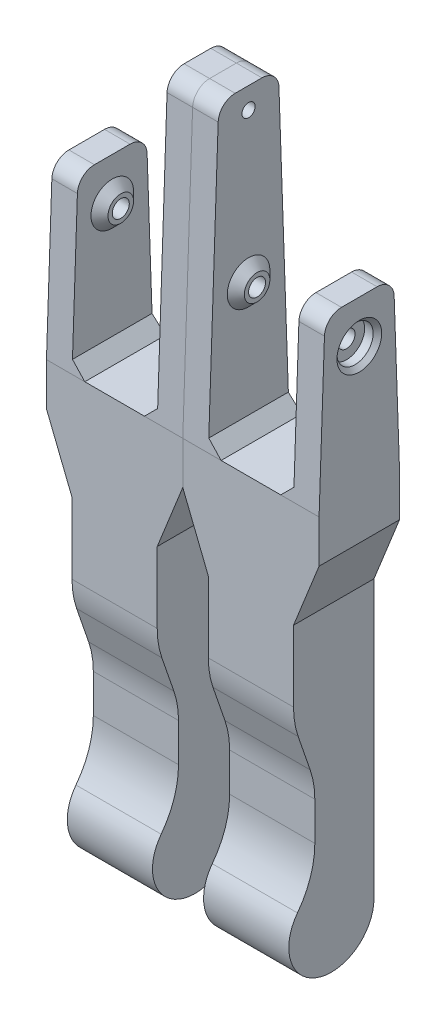
from build123d import *

# Parameters (mm, degrees)
SKETCH1_R           = 2
BOSS_EXTRUDE1_DEPTH = 6
SKETCH2_R           = 4.25
CUT_EXTRUDE1_DEPTH  = 3
SKETCH3_W           = 18.888907728
SKETCH3_H           = 10
BOSS_EXTRUDE2_DEPTH = 32
BOSS_EXTRUDE3_START = -6
SKETCH4_R           = 2
BOSS_EXTRUDE3_DEPTH = 6
FILLET1_R           = 4
CUT_EXTRUDE2_START  = -29
SKETCH2_2_R         = 4.25
CUT_EXTRUDE2_DEPTH  = 3
CHAMFER1_SIZE       = 1
CHAMFER2_SIZE       = 3
SKETCH5_R           = 3
SKETCH5_R_2         = 2
BOSS_EXTRUDE4_DEPTH = 2
BOSS_EXTRUDE5_START = 18
SKETCH5_2_R         = 3
SKETCH5_2_R_2       = 2
BOSS_EXTRUDE5_DEPTH = 2
CHAMFER4_SIZE       = 2
BOSS_EXTRUDE6_DEPTH = 18.888907729
BOSS_EXTRUDE7_DEPTH = 20
CHAMFER5_SIZE       = 15
CHAMFER5_SIZE_2     = 5.164914199
FILLET2_R           = 20
SKETCH9_R           = 1.55
CUT_EXTRUDE3_DEPTH  = 6
CUT_EXTRUDE4_START  = -3
SKETCH10_R          = 3.25
SKETCH10_R_2        = 1.55
CUT_EXTRUDE4_DEPTH  = 3
CHAMFER6_SIZE       = 1


# Some blends are built 0.0001 mm under size
with BuildPart() as part:
    # Sketch1 → Boss-Extrude1 (new body)
    with BuildSketch(Plane(origin=(0, 0, 0), x_dir=(0, 0, -1), z_dir=(1, 0, 0))):
        Polygon((-9.444453864, -30), (-7, 40), (7, 40), (9.444453864, -30), align=None)
        Circle(SKETCH1_R, mode=Mode.SUBTRACT)
    extrude(amount=BOSS_EXTRUDE1_DEPTH)

    # Sketch2 → Cut-Extrude1 (cut)
    with BuildSketch(Plane.ZY):
        Circle(SKETCH2_R)
    extrude(amount=-CUT_EXTRUDE1_DEPTH, mode=Mode.SUBTRACT)

    # Sketch3 → Boss-Extrude2 (add)
    with BuildSketch(Plane.ZY):
        with Locations((0, -35)):
            Rectangle(SKETCH3_W, SKETCH3_H)
    extrude(amount=-BOSS_EXTRUDE2_DEPTH)

    # Sketch4 → Boss-Extrude3 (add)
    with BuildSketch(Plane(origin=(32, 0, 0), x_dir=(0, 0, -1), z_dir=(1, 0, 0)).offset(BOSS_EXTRUDE3_START)):
        Polygon((9.444453864, -30), (-9.444453864, -30), (-8.047623085, 10), (8.047623085, 10), align=None)
        with Locations(Location((0, 0, 0), (0, 0, 180))):
            Circle(SKETCH4_R, mode=Mode.SUBTRACT)
    extrude(amount=BOSS_EXTRUDE3_DEPTH)

    # Fillet1
    fillet1_edges = [part.edges().sort_by_distance(p)[0] for p in [
        (29, 10, -8.047623085),
        (29, 10, 8.047623085),
        (3, 40, 7),
        (3, 40, -7),
    ]]
    fillet(fillet1_edges, radius=FILLET1_R)

    # Sketch2<2> → Cut-Extrude2 (cut)
    with BuildSketch(Plane.ZY.offset(CUT_EXTRUDE2_START)):
        Circle(SKETCH2_2_R)
    extrude(amount=-CUT_EXTRUDE2_DEPTH, mode=Mode.SUBTRACT)

    # Chamfer1
    chamfer1_edges = [part.edges().sort_by_distance(p)[0] for p in [
        (0, 0, -4.25),
        (32, 0, -4.25),
    ]]
    chamfer(chamfer1_edges, length=CHAMFER1_SIZE)

    # Chamfer2
    chamfer2_edges = [part.edges().sort_by_distance(p)[0] for p in [
        (26, -30, 0),
        (6, -30, 0),
    ]]
    chamfer(chamfer2_edges, length=CHAMFER2_SIZE)

    # Sketch5 → Boss-Extrude4 (add)
    with BuildSketch(Plane(origin=(6, 0, 0), x_dir=(0, 0, -1), z_dir=(1, 0, 0))):
        with Locations(Location((0, 0, 0), (0, 0, 180))):
            Circle(SKETCH5_R)
        with Locations(Location((0, 0, 0), (0, 0, 180))):
            Circle(SKETCH5_R_2, mode=Mode.SUBTRACT)
    extrude(amount=BOSS_EXTRUDE4_DEPTH)

    # Sketch5<2> → Boss-Extrude5 (add)
    with BuildSketch(Plane(origin=(6, 0, 0), x_dir=(0, 0, -1), z_dir=(1, 0, 0)).offset(BOSS_EXTRUDE5_START)):
        with Locations(Location((0, 0, 0), (0, 0, 180))):
            Circle(SKETCH5_2_R)
        with Locations(Location((0, 0, 0), (0, 0, 180))):
            Circle(SKETCH5_2_R_2, mode=Mode.SUBTRACT)
    extrude(amount=BOSS_EXTRUDE5_DEPTH)

    # Chamfer4
    chamfer4_edges = [part.edges().sort_by_distance(p)[0] for p in [
        (6, 0, -3),
        (26, 0, -3),
    ]]
    chamfer(chamfer4_edges, length=CHAMFER4_SIZE - 0.0001)  # a hair under: the kernel refuses the full size

    # Sketch7 → Boss-Extrude6 (add)
    with BuildSketch(Plane(origin=(0, 0, -9.444453864), x_dir=(-1, 0, 0), z_dir=(0, 0, -1))):
        Polygon((-32, -40), (-26, -55), (-26, -60), (-6, -60), (-6, -55), (0, -40), align=None)
    extrude(amount=-BOSS_EXTRUDE6_DEPTH)

    # Sketch8 → Boss-Extrude7 (add)
    with BuildSketch(Plane(origin=(26, 0, 0), x_dir=(0, 0, -1), z_dir=(1, 0, 0))):
        with BuildLine():
            Line((9.444453864, -60), (-9.444453864, -60))
            Line((-9.444453864, -60), (-9.444453864, -90))
            Line((-9.444453864, -90), (-4.444453864, -90))
            Line((-4.444453864, -90), (-4.444453864, -110.787161313))
            ThreePointArc((-4.444453864, -110.787161313), (-6.083245599, -128.333338985), (9.444453864, -120))
            Line((9.444453864, -120), (9.444453864, -60))
        make_face()
    extrude(amount=-BOSS_EXTRUDE7_DEPTH)

    # Chamfer5
    # the kernel refuses this chamfer: 15, 5.164914199 mm, written as the material it takes off along each edge
    with BuildSketch(Plane(origin=(64.9213417, -90, 9.444453864), x_dir=(0, 0.9999212813122312, 0.012547158200392249), z_dir=(-1, 0, 0))) as chamfer5_piece_1_section:
        Polygon((CHAMFER5_SIZE * 0.999921281312, CHAMFER5_SIZE * 0.0125471582004), (-CHAMFER5_SIZE_2 * 0.0125471582012, CHAMFER5_SIZE_2 * 0.999921281379), (0, 0), align=None)
    chamfer5_piece_1 = extrude(amount=97.842683401, mode=Mode.PRIVATE)
    chamfer5_piece_1 = split(chamfer5_piece_1, bisect_by=Plane(origin=(16, -84.819367326, 4.444453864), z_dir=(0, 0, 1)), keep=Keep.TOP, mode=Mode.PRIVATE)
    add(chamfer5_piece_1, mode=Mode.SUBTRACT)

    # Fillet2
    fillet2_edges = [part.edges().sort_by_distance(p)[0] for p in [
        (16, -110.787161313, 4.444453864),
        (16, -75, 9.444453864),
        (16, -89.521054388, 4.444453864),
    ]]
    fillet(fillet2_edges, radius=FILLET2_R)

    # Sketch9 → Cut-Extrude3 (cut)
    with BuildSketch(Plane(origin=(6, 0, 0), x_dir=(0, 0, -1), z_dir=(1, 0, 0))):
        with Locations((0, 35)):
            Circle(SKETCH9_R)
    extrude(amount=-CUT_EXTRUDE3_DEPTH, mode=Mode.SUBTRACT)

    # Sketch10 → Cut-Extrude4 (cut)
    with BuildSketch(Plane.ZY.offset(CUT_EXTRUDE4_START)):
        with Locations((0, 35)):
            Circle(SKETCH10_R)
        with Locations(Location((0, 35, 0), (0, 0, 180))):
            Circle(SKETCH10_R_2, mode=Mode.SUBTRACT)
    extrude(amount=CUT_EXTRUDE4_DEPTH, mode=Mode.SUBTRACT)

    # Chamfer6
    chamfer6_edges = [part.edges().sort_by_distance(p)[0] for p in [
        (0, 35, -3.25),
    ]]
    chamfer(chamfer6_edges, length=CHAMFER6_SIZE)


with BuildPart() as body_2:
    # Mirror1: mirrored copy
    add(part.part.mirror(Plane(origin=(0, 0, 0), x_dir=(0, 0, 1), z_dir=(1, 0, 0))))


solid = Compound([part.part, body_2.part])
